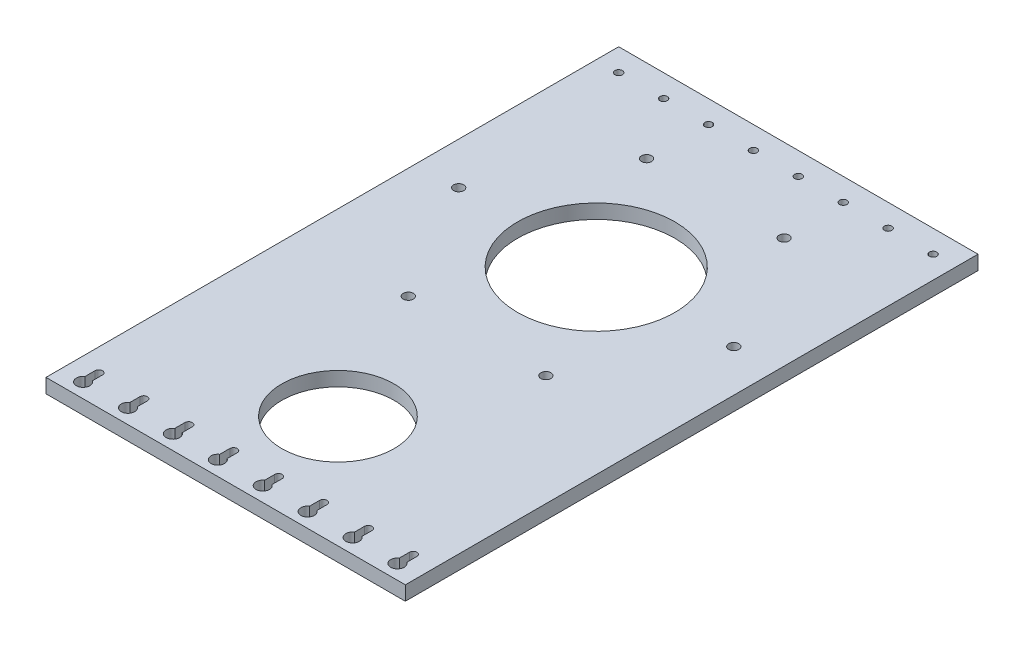
from build123d import *

# Parameters (mm, degrees)
SKETCH1_W           = 160
SKETCH1_H           = 255
SKETCH1_R           = 2.25
SKETCH1_R_2         = 25
SKETCH1_R_3         = 1.65
SKETCH1_R_4         = 35
BOSS_EXTRUDE1_DEPTH = 6.35
CUT_EXTRUDE1_REACH  = 303.107
SKETCH2_R           = 3


with BuildPart() as part:
    # Sketch1 → Boss-Extrude1 (new body)
    with BuildSketch(Plane(origin=(0, 0, 0), x_dir=(1, 0, 0), z_dir=(0, 1, 0))):
        with Locations((80, 127.5)):
            Rectangle(SKETCH1_W, SKETCH1_H)
        with BuildLine():
            ThreePointArc((11.65, 6.5), (10, 4.85), (8.35, 6.5))
            Line((8.35, 6.5), (8.35, 13.5))
            ThreePointArc((8.35, 13.5), (10, 15.15), (11.65, 13.5))
            Line((11.65, 13.5), (11.65, 6.5))
        make_face(mode=Mode.SUBTRACT)
        with BuildLine():
            Line((31.65, 13.5), (31.65, 6.5))
            ThreePointArc((31.65, 6.5), (30, 4.85), (28.35, 6.5))
            Line((28.35, 6.5), (28.35, 13.5))
            ThreePointArc((28.35, 13.5), (30, 15.15), (31.65, 13.5))
        make_face(mode=Mode.SUBTRACT)
        with BuildLine():
            Line((51.65, 13.5), (51.65, 6.5))
            ThreePointArc((51.65, 6.5), (50, 4.85), (48.35, 6.5))
            Line((48.35, 6.5), (48.35, 13.5))
            ThreePointArc((48.35, 13.5), (50, 15.15), (51.65, 13.5))
        make_face(mode=Mode.SUBTRACT)
        with BuildLine():
            Line((71.65, 13.5), (71.65, 6.5))
            ThreePointArc((71.65, 6.5), (70, 4.85), (68.35, 6.5))
            Line((68.35, 6.5), (68.35, 13.5))
            ThreePointArc((68.35, 13.5), (70, 15.15), (71.65, 13.5))
        make_face(mode=Mode.SUBTRACT)
        with Locations((49.375, 111.955944018)):
            Circle(SKETCH1_R, mode=Mode.SUBTRACT)
        with BuildLine():
            Line((91.65, 13.5), (91.65, 6.5))
            ThreePointArc((91.65, 6.5), (90, 4.85), (88.35, 6.5))
            Line((88.35, 6.5), (88.35, 13.5))
            ThreePointArc((88.35, 13.5), (90, 15.15), (91.65, 13.5))
        make_face(mode=Mode.SUBTRACT)
        with BuildLine():
            Line((111.65, 13.5), (111.65, 6.5))
            ThreePointArc((111.65, 6.5), (110, 4.85), (108.35, 6.5))
            Line((108.35, 6.5), (108.35, 13.5))
            ThreePointArc((108.35, 13.5), (110, 15.15), (111.65, 13.5))
        make_face(mode=Mode.SUBTRACT)
        with Locations((80, 50)):
            Circle(SKETCH1_R_2, mode=Mode.SUBTRACT)
        with BuildLine():
            Line((131.65, 13.5), (131.65, 6.5))
            ThreePointArc((131.65, 6.5), (130, 4.85), (128.35, 6.5))
            Line((128.35, 6.5), (128.35, 13.5))
            ThreePointArc((128.35, 13.5), (130, 15.15), (131.65, 13.5))
        make_face(mode=Mode.SUBTRACT)
        with BuildLine():
            Line((151.65, 13.5), (151.65, 6.5))
            ThreePointArc((151.65, 6.5), (150, 4.85), (148.35, 6.5))
            Line((148.35, 6.5), (148.35, 13.5))
            ThreePointArc((148.35, 13.5), (150, 15.15), (151.65, 13.5))
        make_face(mode=Mode.SUBTRACT)
        with Locations((110.625, 111.955944018)):
            Circle(SKETCH1_R, mode=Mode.SUBTRACT)
        with Locations((18.75, 165)):
            Circle(SKETCH1_R, mode=Mode.SUBTRACT)
        with Locations((10, 245)):
            Circle(SKETCH1_R_3, mode=Mode.SUBTRACT)
        with Locations((30, 245)):
            Circle(SKETCH1_R_3, mode=Mode.SUBTRACT)
        with Locations((49.375, 218.044055982)):
            Circle(SKETCH1_R, mode=Mode.SUBTRACT)
        with Locations((50, 245)):
            Circle(SKETCH1_R_3, mode=Mode.SUBTRACT)
        with Locations((70, 245)):
            Circle(SKETCH1_R_3, mode=Mode.SUBTRACT)
        with Locations((80, 165)):
            Circle(SKETCH1_R_4, mode=Mode.SUBTRACT)
        with Locations((141.25, 165)):
            Circle(SKETCH1_R, mode=Mode.SUBTRACT)
        with Locations((110.625, 218.044055982)):
            Circle(SKETCH1_R, mode=Mode.SUBTRACT)
        with Locations((90, 245)):
            Circle(SKETCH1_R_3, mode=Mode.SUBTRACT)
        with Locations((110, 245)):
            Circle(SKETCH1_R_3, mode=Mode.SUBTRACT)
        with Locations((130, 245)):
            Circle(SKETCH1_R_3, mode=Mode.SUBTRACT)
        with Locations((150, 245)):
            Circle(SKETCH1_R_3, mode=Mode.SUBTRACT)
    extrude(amount=BOSS_EXTRUDE1_DEPTH)

    # Sketch2 → Cut-Extrude1 (cut, up to next)
    with BuildSketch(Plane(origin=(0, 6.35, 0), x_dir=(1, 0, 0), z_dir=(0, 1, 0)), mode=Mode.PRIVATE) as cut_extrude1_sk1:
        with Locations((150, 6.5)):
            Circle(SKETCH2_R)
    cut_extrude1_tool1 = extrude(cut_extrude1_sk1.sketch, amount=-CUT_EXTRUDE1_REACH, mode=Mode.PRIVATE) & part.part
    # Sketch2 → Cut-Extrude1 (cut, up to next)
    with BuildSketch(Plane(origin=(0, 6.35, 0), x_dir=(1, 0, 0), z_dir=(0, 1, 0)), mode=Mode.PRIVATE) as cut_extrude1_sk2:
        with Locations((130, 6.5)):
            Circle(SKETCH2_R)
    cut_extrude1_tool2 = extrude(cut_extrude1_sk2.sketch, amount=-CUT_EXTRUDE1_REACH, mode=Mode.PRIVATE) & part.part
    # Sketch2 → Cut-Extrude1 (cut, up to next)
    with BuildSketch(Plane(origin=(0, 6.35, 0), x_dir=(1, 0, 0), z_dir=(0, 1, 0)), mode=Mode.PRIVATE) as cut_extrude1_sk3:
        with Locations((110, 6.5)):
            Circle(SKETCH2_R)
    cut_extrude1_tool3 = extrude(cut_extrude1_sk3.sketch, amount=-CUT_EXTRUDE1_REACH, mode=Mode.PRIVATE) & part.part
    # Sketch2 → Cut-Extrude1 (cut, up to next)
    with BuildSketch(Plane(origin=(0, 6.35, 0), x_dir=(1, 0, 0), z_dir=(0, 1, 0)), mode=Mode.PRIVATE) as cut_extrude1_sk4:
        with Locations((90, 6.5)):
            Circle(SKETCH2_R)
    cut_extrude1_tool4 = extrude(cut_extrude1_sk4.sketch, amount=-CUT_EXTRUDE1_REACH, mode=Mode.PRIVATE) & part.part
    # Sketch2 → Cut-Extrude1 (cut, up to next)
    with BuildSketch(Plane(origin=(0, 6.35, 0), x_dir=(1, 0, 0), z_dir=(0, 1, 0)), mode=Mode.PRIVATE) as cut_extrude1_sk5:
        with Locations((70, 6.5)):
            Circle(SKETCH2_R)
    cut_extrude1_tool5 = extrude(cut_extrude1_sk5.sketch, amount=-CUT_EXTRUDE1_REACH, mode=Mode.PRIVATE) & part.part
    # Sketch2 → Cut-Extrude1 (cut, up to next)
    with BuildSketch(Plane(origin=(0, 6.35, 0), x_dir=(1, 0, 0), z_dir=(0, 1, 0)), mode=Mode.PRIVATE) as cut_extrude1_sk6:
        with Locations((50, 6.5)):
            Circle(SKETCH2_R)
    cut_extrude1_tool6 = extrude(cut_extrude1_sk6.sketch, amount=-CUT_EXTRUDE1_REACH, mode=Mode.PRIVATE) & part.part
    # Sketch2 → Cut-Extrude1 (cut, up to next)
    with BuildSketch(Plane(origin=(0, 6.35, 0), x_dir=(1, 0, 0), z_dir=(0, 1, 0)), mode=Mode.PRIVATE) as cut_extrude1_sk7:
        with Locations((30, 6.5)):
            Circle(SKETCH2_R)
    cut_extrude1_tool7 = extrude(cut_extrude1_sk7.sketch, amount=-CUT_EXTRUDE1_REACH, mode=Mode.PRIVATE) & part.part
    # Sketch2 → Cut-Extrude1 (cut, up to next)
    with BuildSketch(Plane(origin=(0, 6.35, 0), x_dir=(1, 0, 0), z_dir=(0, 1, 0)), mode=Mode.PRIVATE) as cut_extrude1_sk8:
        with Locations((10, 6.5)):
            Circle(SKETCH2_R)
    cut_extrude1_tool8 = extrude(cut_extrude1_sk8.sketch, amount=-CUT_EXTRUDE1_REACH, mode=Mode.PRIVATE) & part.part
    add(cut_extrude1_tool1.solids().sort_by_distance((150, 6.35, -6.5))[0], mode=Mode.SUBTRACT)
    add(cut_extrude1_tool2.solids().sort_by_distance((130, 6.35, -6.5))[0], mode=Mode.SUBTRACT)
    add(cut_extrude1_tool3.solids().sort_by_distance((110, 6.35, -6.5))[0], mode=Mode.SUBTRACT)
    add(cut_extrude1_tool4.solids().sort_by_distance((90, 6.35, -6.5))[0], mode=Mode.SUBTRACT)
    add(cut_extrude1_tool5.solids().sort_by_distance((70, 6.35, -6.5))[0], mode=Mode.SUBTRACT)
    add(cut_extrude1_tool6.solids().sort_by_distance((50, 6.35, -6.5))[0], mode=Mode.SUBTRACT)
    add(cut_extrude1_tool7.solids().sort_by_distance((30, 6.35, -6.5))[0], mode=Mode.SUBTRACT)
    add(cut_extrude1_tool8.solids().sort_by_distance((10, 6.35, -6.5))[0], mode=Mode.SUBTRACT)


solid = part.part
